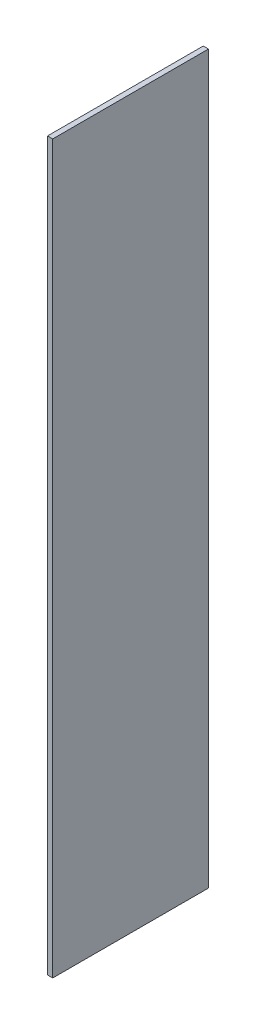
from build123d import *

# Parameters (mm, degrees)
SKETCH1_W           = 0.1
SKETCH1_H           = 14
BOSS_EXTRUDE1_DEPTH = 3


with BuildPart() as part:
    # Sketch1 → Boss-Extrude1 (new body)
    with BuildSketch(Plane.XY):
        with Locations((0.05, 7)):
            Rectangle(SKETCH1_W, SKETCH1_H)
    extrude(amount=BOSS_EXTRUDE1_DEPTH)


solid = part.part
